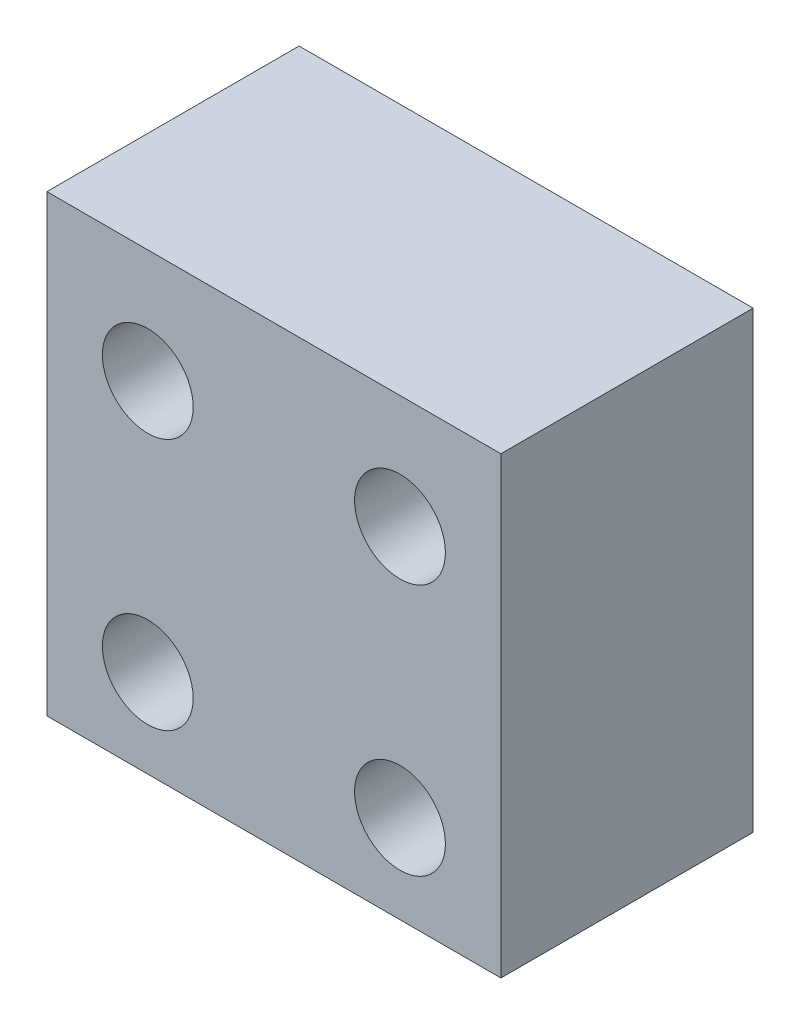
from build123d import *

# Parameters (mm, degrees)
SKETCH1_W            = 18
SKETCH1_H            = 18
BOSS_EXTRUDE1_DEPTH  = 10
M3_CLEARANCE_HOLE1_D = 3.6


with BuildPart() as part:
    # Sketch1 → Boss-Extrude1 (new body)
    with BuildSketch(Plane.XY):
        with Locations((160.000000073, 95.998999469)):
            Rectangle(SKETCH1_W, SKETCH1_H)
    extrude(amount=BOSS_EXTRUDE1_DEPTH)

    # M3 Clearance Hole1 (through all)
    with Locations(Plane.XY.offset(10)):
        with Locations((165.000000084, 90.498999424), (155.000000084, 90.498999456), (155.000000116, 100.498999456), (165.000000116, 100.498999424)):
            Hole(M3_CLEARANCE_HOLE1_D / 2)


solid = part.part
